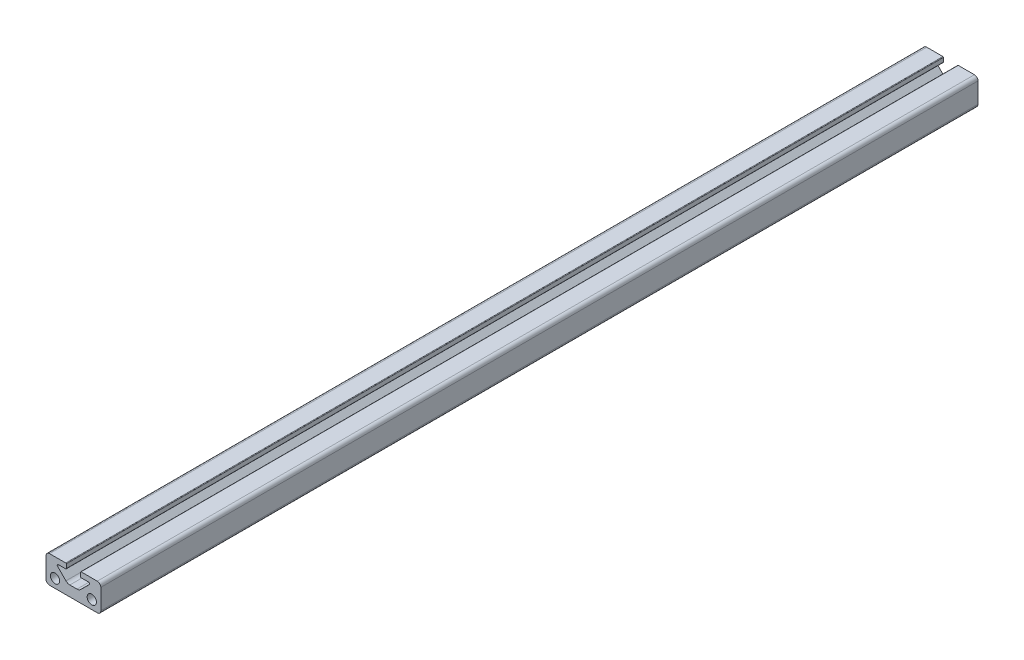
from build123d import *

# Parameters (mm, degrees)
SKETCH3_R           = 2.1463
BOSS_EXTRUDE1_DEPTH = 203.2
FILLET1_R           = 0.254


with BuildPart() as part:
    # Sketch3 → Boss-Extrude1 (new, symmetric)
    with BuildSketch(Plane.XY):
        with BuildLine():
            Line((-11.049, 12.7), (-3.302, 12.7))
            Line((-3.302, 12.7), (-3.302, 10.328863887))
            Line((-3.302, 10.328863887), (-6.985, 10.328863887))
            ThreePointArc((-6.985, 10.328863887), (-7.454330803, 10.01526707), (-7.344210245, 9.461653642))
            Line((-7.344210245, 9.461653642), (-3.452505379, 5.569948776))
            ThreePointArc((-3.452505379, 5.569948776), (-2.628470073, 5.019345987), (-1.656454155, 4.826))
            Line((-1.656454155, 4.826), (1.656454155, 4.826))
            ThreePointArc((1.656454155, 4.826), (2.628470073, 5.019345987), (3.452505379, 5.569948776))
            Line((3.452505379, 5.569948776), (7.344210245, 9.461653642))
            ThreePointArc((7.344210245, 9.461653642), (7.454330803, 10.01526707), (6.985, 10.328863887))
            Line((6.985, 10.328863887), (3.302, 10.328863887))
            Line((3.302, 10.328863887), (3.302, 12.7))
            Line((3.302, 12.7), (11.049, 12.7))
            ThreePointArc((11.049, 12.7), (12.216433296, 12.216433296), (12.7, 11.049))
            Line((12.7, 11.049), (12.7, 1.651))
            ThreePointArc((12.7, 1.651), (12.216433296, 0.483566704), (11.049, 0))
            Line((11.049, 0), (-11.049, 0))
            ThreePointArc((-11.049, 0), (-12.216433296, 0.483566704), (-12.7, 1.651))
            Line((-12.7, 1.651), (-12.7, 11.049))
            ThreePointArc((-12.7, 11.049), (-12.216433296, 12.216433296), (-11.049, 12.7))
        make_face()
        with Locations((8.509, 4.064)):
            Circle(SKETCH3_R, mode=Mode.SUBTRACT)
        with Locations((-8.509, 4.064)):
            Circle(SKETCH3_R, mode=Mode.SUBTRACT)
    extrude(amount=BOSS_EXTRUDE1_DEPTH, both=True)

    # Fillet1
    fillet1_edges = [part.edges().sort_by_distance(p)[0] for p in [
        (3.302, 10.328863887, 0),
        (3.302, 12.7, 0),
        (-3.302, 10.328863887, 0),
        (-3.302, 12.7, 0),
    ]]
    fillet(fillet1_edges, radius=FILLET1_R)


solid = part.part
